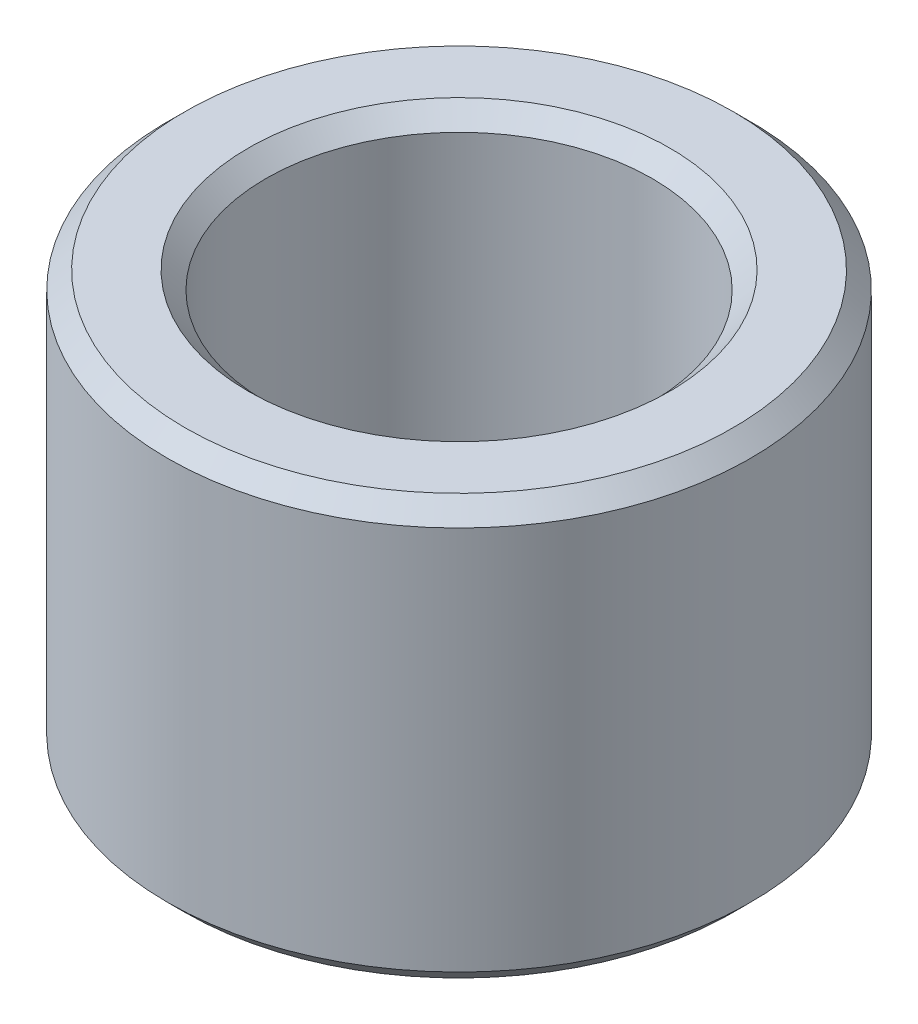
from build123d import *

# Parameters (mm, degrees)
SKETCH1_R           = 15
BOSS_EXTRUDE1_DEPTH = 21.59445194
SKETCH2_R           = 9.936770329
CUT_EXTRUDE1_DEPTH  = 31.270783845
CHAMFER1_SIZE       = 0.905493661


with BuildPart() as part:
    # Sketch1 → Boss-Extrude1 (new body)
    with BuildSketch(Plane(origin=(0, 0, 0), x_dir=(1, 0, 0), z_dir=(0, 1, 0))):
        Circle(SKETCH1_R)
    extrude(amount=BOSS_EXTRUDE1_DEPTH)

    # Sketch2 → Cut-Extrude1 (cut, through all)
    with BuildSketch(Plane(origin=(0, 0, 0), x_dir=(1, 0, 0), z_dir=(0, 1, 0))):
        Circle(SKETCH2_R)
    extrude(amount=CUT_EXTRUDE1_DEPTH, mode=Mode.SUBTRACT)

    # Chamfer1
    chamfer1_edges = [part.edges().sort_by_distance(p)[0] for p in [
        (-9.936770329, 21.59445194, 0),
        (-9.936770329, 0, 0),
        (-15, 0, 0),
        (-15, 21.59445194, 0),
    ]]
    chamfer(chamfer1_edges, length=CHAMFER1_SIZE)


solid = part.part
